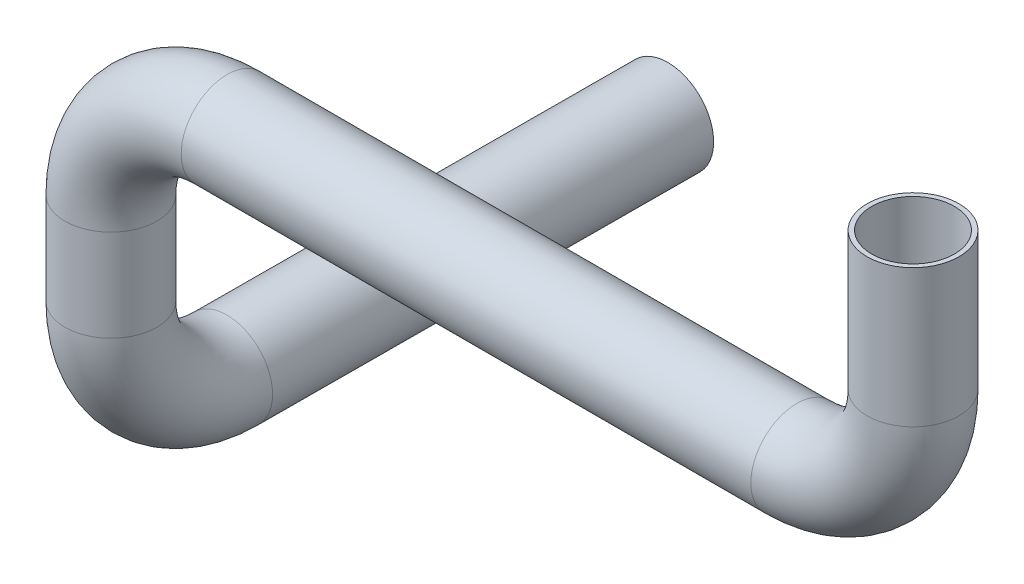
from build123d import *

# Parameters (mm, degrees)
SKETCH1_R          = 5
SWEEP2_START       = -60.650300513
SWEEP2_OUTLINE_R   = 5
SWEEP2_DEPTH       = 48.00040805
SWEEP2_2_OUTLINE_R = 5
SWEEP2_2_ANGLE     = 89.76375
SHELL1_T           = -0.5


with BuildPart() as part:
    # Sweep1: sweep along a path in Sketch2
    with BuildLine(Plane.XY) as sweep1_path:
        Line((0, 0), (0, 10))
        ThreePointArc((0, 10), (3.705099218, 18.944900782), (12.65, 22.65))
        Line((12.65, 22.65), (74.65, 22.65))
        ThreePointArc((74.65, 22.65), (83.594900782, 26.355099218), (87.3, 35.3))
        Line((87.3, 35.3), (87.3, 50.3))
    # Sketch1 → Sweep1 (sweep)
    with BuildSketch(Plane(origin=(0, 0, 0), x_dir=(1, 0, 0), z_dir=(0, 1, 0))):
        Circle(SKETCH1_R)
    sweep(path=sweep1_path.line)



with BuildPart() as body_2:
    # Sweep2: read off the stored shape, not the designer's step
    # Sweep2 outline → Sweep2 (new body)
    with BuildSketch(Plane(origin=(0, 0, 0), x_dir=(1, 0, 0), z_dir=(0, 0.00412333182871543, 0.999991499031182)).offset(SWEEP2_START)):
        with Locations((0, -12.597839852)):
            Circle(SWEEP2_OUTLINE_R)
    extrude(amount=SWEEP2_DEPTH)


with BuildPart() as part_1:
    add(part.part)

    add(body_2.part)  # Sweep2 2 merges body 2
    # Sweep2 2 outline → Sweep2 2 (revolve)
    with BuildSketch(Plane(origin=(0, 0, -12.65), x_dir=(0, 0, 1), z_dir=(0, 1, 0))):
        with Locations((12.65, 0)):
            Circle(SWEEP2_2_OUTLINE_R)
    revolve(axis=Axis((0, 0, -12.65), (1, 0, 0)), revolution_arc=SWEEP2_2_ANGLE)

    # Shell1
    shell1_openings = [part_1.faces().sort_by_distance(p)[0] for p in [
        (0, -12.847814073, -60.597839853),
        (87.3, 50.3, 0),
    ]]
    offset(amount=SHELL1_T, openings=shell1_openings, kind=Kind.INTERSECTION)


solid = part_1.part
